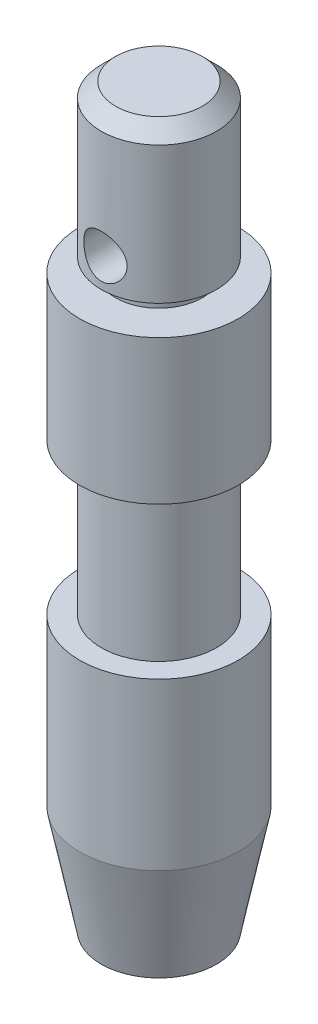
from build123d import *

# Parameters (mm, degrees)
ESQUISSE2_R                  = 5.5
BOSS_EXTRU_2_DEPTH           = 19
CHANFREIN1_SIZE              = 1.5
CHANFREIN1_SIZE2             = 7.5
ESQUISSE8_R                  = 4
BOSS_EXTRU_3_DEPTH           = 10.5
ESQUISSE9_R                  = 5.5
BOSS_EXTRU_4_DEPTH           = 10
ESQUISSE10_R                 = 3
BOSS_EXTRU_5_DEPTH           = 1
ESQUISSE12_R                 = 4
BOSS_EXTRU_6_DEPTH           = 10.5
CHANFREIN2_SIZE              = 1
ENL_V_MAT_EXTRU_1_DEPTH      = 52.58972766
ENL_V_MAT_EXTRU_1_DEPTH_BACK = 52.58972766
ESQUISSE15_R                 = 1.5


with BuildPart() as part:
    # Esquisse2 → Boss.-Extru.2 (new body)
    with BuildSketch(Plane(origin=(0, 0, 0), x_dir=(1, 0, 0), z_dir=(0, 1, 0))):
        Circle(ESQUISSE2_R)
    extrude(amount=BOSS_EXTRU_2_DEPTH)

    # Chanfrein1
    chanfrein1_edges = [part.edges().sort_by_distance(p)[0] for p in [
        (-5.5, 0, 0),
    ]]
    chanfrein1_side = [part.faces().sort_by_distance(p)[0] for p in [
        (0, 0, 0),
    ]]
    chamfer(chanfrein1_edges, length=CHANFREIN1_SIZE, length2=CHANFREIN1_SIZE2, reference=chanfrein1_side[0])

    # Esquisse8 → Boss.-Extru.3 (add)
    with BuildSketch(Plane(origin=(0, 19, 0), x_dir=(1, 0, 0), z_dir=(0, 1, 0))):
        Circle(ESQUISSE8_R)
    extrude(amount=BOSS_EXTRU_3_DEPTH)

    # Esquisse9 → Boss.-Extru.4 (add)
    with BuildSketch(Plane(origin=(0, 29.5, 0), x_dir=(1, 0, 0), z_dir=(0, 1, 0))):
        Circle(ESQUISSE9_R)
    extrude(amount=BOSS_EXTRU_4_DEPTH)

    # Esquisse10 → Boss.-Extru.5 (add)
    with BuildSketch(Plane(origin=(0, 39.5, 0), x_dir=(1, 0, 0), z_dir=(0, 1, 0))):
        Circle(ESQUISSE10_R)
    extrude(amount=BOSS_EXTRU_5_DEPTH)

    # Esquisse12 → Boss.-Extru.6 (add)
    with BuildSketch(Plane(origin=(0, 40.5, 0), x_dir=(1, 0, 0), z_dir=(0, 1, 0))):
        Circle(ESQUISSE12_R)
    extrude(amount=BOSS_EXTRU_6_DEPTH)

    # Chanfrein2
    chanfrein2_edges = [part.edges().sort_by_distance(p)[0] for p in [
        (-4, 51, 0),
    ]]
    chamfer(chanfrein2_edges, length=CHANFREIN2_SIZE)

    # Esquisse15 → Enlèv. mat.-Extru.1 (cut, two sides: drawn at the far end of the back side and taken through both)
    with BuildSketch(Plane.XY.offset(-ENL_V_MAT_EXTRU_1_DEPTH_BACK)):
        with Locations((0, 42.5)):
            Circle(ESQUISSE15_R)
    extrude(amount=ENL_V_MAT_EXTRU_1_DEPTH + ENL_V_MAT_EXTRU_1_DEPTH_BACK, mode=Mode.SUBTRACT)


solid = part.part
